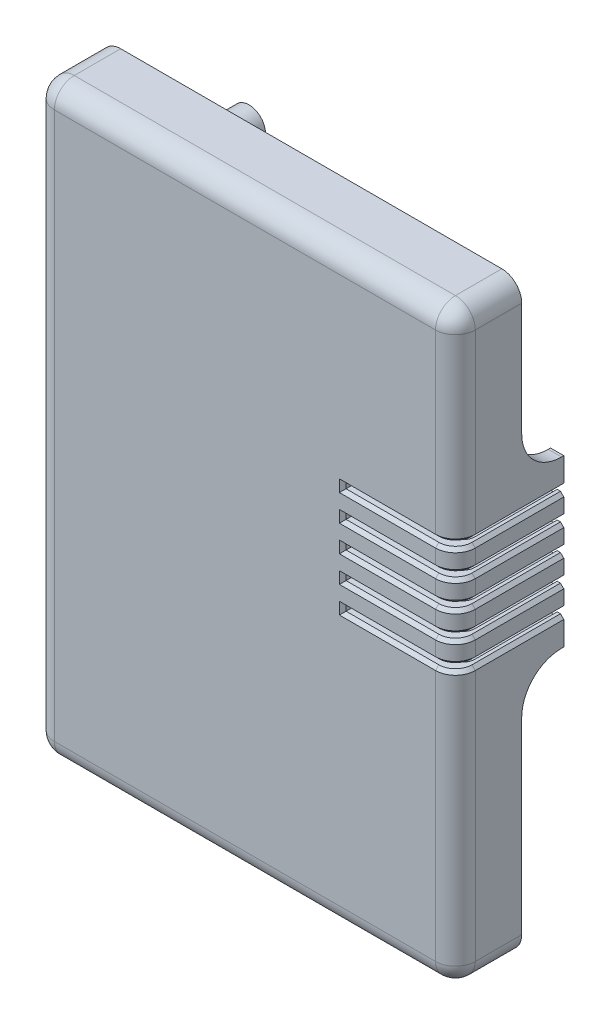
from build123d import *

# Parameters (mm, degrees)
SKETCH2_W                  = 63.5
SKETCH2_H                  = 88.5
BOSS_EXTRUDE1_DEPTH        = 2
BOSS_EXTRUDE2_DEPTH        = 8
BOSS_EXTRUDE3_DEPTH        = 2
SKETCH5_W                  = 15
SKETCH5_H                  = 2
BOSS_EXTRUDE4_DEPTH        = 12
CUT_EXTRUDE1_DEPTH         = 14.35
FILLET1_R                  = 3
FILLET2_R                  = 2
FILLET3_R                  = 3
SKETCH7_W                  = 16.828427125
SKETCH7_H                  = 0.8
CUT_EXTRUDE2_DEPTH         = 10
SKETCH9_R                  = 2.5
BOSS_EXTRUDE5_DEPTH        = 14.35
BOSS_EXTRUDE6_DEPTH        = 0.5
BOSS_EXTRUDE7_DEPTH        = 0.5
BOSS_EXTRUDE8_DEPTH        = 0.5
SKETCH17_W                 = 5.5
SKETCH17_H                 = 9
BOSS_EXTRUDE11_DEPTH       = 0.5
BOSS_EXTRUDE12_DEPTH       = 0.5
BOSS_EXTRUDE13_DEPTH       = 0.5
M2_5_CLEARANCE_HOLE1_D     = 2.9
M2_5_CLEARANCE_HOLE1_DEPTH = 10
M2_5_CLEARANCE_HOLE1_TIP   = 0.871247898
SKETCH8_W                  = 26.800079737
SKETCH8_H                  = 7
CUT_EXTRUDE3_DEPTH         = 3
CHAMFER1_SIZE              = 0.5


with BuildPart() as part:
    # Sketch2 → Boss-Extrude1 (new body)
    with BuildSketch(Plane.XY.offset(8)):
        with Locations((8.071244, 16.046786)):
            Rectangle(SKETCH2_W, SKETCH2_H)
    extrude(amount=BOSS_EXTRUDE1_DEPTH)

    # Sketch3 → Boss-Extrude2 (add)
    with BuildSketch(Plane(origin=(0, 0, 8), x_dir=(-1, 0, 0), z_dir=(0, 0, -1))):
        Polygon((23.678756, -28.203214), (23.678756, 60.296786), (-39.821244, 60.296786), (-39.821244, 58.296786), (-37.821244, 58.296786), (21.678756, 58.296786), (21.678756, -26.203214), (-37.821244, -26.203214), (-39.821244, -26.203214), (-39.821244, -28.203214), align=None)
    extrude(amount=BOSS_EXTRUDE2_DEPTH)

    # Sketch4 → Boss-Extrude3 (add)
    with BuildSketch(Plane(origin=(39.821244, 0, 0), x_dir=(0, 0, -1), z_dir=(1, 0, 0))):
        with BuildLine():
            ThreePointArc((6, 9.206977335), (1.757359313, 7.449618022), (0, 3.206977335))
            Line((0, 3.206977335), (0, -26.203214))
            Line((0, -26.203214), (-8, -26.203214))
            Line((-8, -26.203214), (-8, 58.296786))
            Line((-8, 58.296786), (0, 58.296786))
            Line((0, 58.296786), (0, 40.206977335))
            ThreePointArc((0, 40.206977335), (1.757359313, 35.964336648), (6, 34.206977335))
            Line((6, 34.206977335), (6.35, 34.206977335))
            Line((6.35, 34.206977335), (6.35, 9.206977335))
            Line((6.35, 9.206977335), (6, 9.206977335))
        make_face()
    extrude(amount=-BOSS_EXTRUDE3_DEPTH)

    # Sketch5 → Boss-Extrude4 (add)
    with BuildSketch(Plane(origin=(0, 0, 8), x_dir=(-1, 0, 0), z_dir=(0, 0, -1))):
        with Locations((-30.321244, 31.706977335)):
            Rectangle(SKETCH5_W, SKETCH5_H)
        with Locations((-30.321244, 27.706977335)):
            Rectangle(SKETCH5_W, SKETCH5_H)
        with Locations((-30.321244, 23.706977335)):
            Rectangle(SKETCH5_W, SKETCH5_H)
        with Locations((-30.321244, 19.706977335)):
            Rectangle(SKETCH5_W, SKETCH5_H)
        with Locations((-30.321244, 15.706977335)):
            Rectangle(SKETCH5_W, SKETCH5_H)
        with Locations((-30.321244, 11.706977335)):
            Rectangle(SKETCH5_W, SKETCH5_H)
    extrude(amount=BOSS_EXTRUDE4_DEPTH)

    # Sketch6 → Cut-Extrude1 (cut)
    with BuildSketch(Plane(origin=(0, 0, -6.35), x_dir=(-1, 0, 0), z_dir=(0, 0, -1))):
        Polygon((-37.821244, 30.706977335), (-38.821244, 30.706977335), (-38.821244, 30.106977335), (-39.821244, 30.106977335), (-39.821244, 29.306977335), (-38.821244, 29.306977335), (-38.821244, 28.706977335), (-37.821244, 28.706977335), align=None)
        Polygon((-38.821244, 26.106977335), (-39.821244, 26.106977335), (-39.821244, 25.306977335), (-38.821244, 25.306977335), (-38.821244, 24.706977335), (-37.821244, 24.706977335), (-37.821244, 26.706977335), (-38.821244, 26.706977335), align=None)
        Polygon((-38.821244, 22.106977335), (-39.821244, 22.106977335), (-39.821244, 21.306977335), (-38.821244, 21.306977335), (-38.821244, 20.706977335), (-37.821244, 20.706977335), (-37.821244, 22.706977335), (-38.821244, 22.706977335), align=None)
        Polygon((-38.821244, 18.106977335), (-39.821244, 18.106977335), (-39.821244, 17.306977335), (-38.821244, 17.306977335), (-38.821244, 16.706977335), (-37.821244, 16.706977335), (-37.821244, 18.706977335), (-38.821244, 18.706977335), align=None)
        Polygon((-38.821244, 14.106977335), (-39.821244, 14.106977335), (-39.821244, 13.306977335), (-38.821244, 13.306977335), (-38.821244, 12.706977335), (-37.821244, 12.706977335), (-37.821244, 14.706977335), (-38.821244, 14.706977335), align=None)
    extrude(amount=-CUT_EXTRUDE1_DEPTH, mode=Mode.SUBTRACT)

    # Fillet1
    # the kernel refuses this fillet: 3 mm, written as the material it takes off along each edge
    with BuildSketch(Plane(origin=(-23.678756, -35.703214, 10), x_dir=(0, 0, -1), z_dir=(0, 1, 0)), Plane(origin=(39.821244, 67.796786, 10), x_dir=(0, 0, -1), z_dir=(0, -1, 0))) as fillet1_piece_1:
        with BuildLine():
            CenterArc((FILLET1_R, -FILLET1_R), FILLET1_R, 90, 90)
            Line((0, -FILLET1_R), (0, 0))
            Line((0, 0), (FILLET1_R, 0))
        make_face()
    extrude(amount=103.5, mode=Mode.SUBTRACT)
    with BuildSketch(Plane(origin=(47.321244, -28.203214, 10), x_dir=(0, 0, -1), z_dir=(-1, 0, 0)), Plane(origin=(-31.178756, 60.296786, 10), x_dir=(0, 0, -1), z_dir=(1, 0, 0))) as fillet1_piece_2:
        with BuildLine():
            CenterArc((FILLET1_R, -FILLET1_R), FILLET1_R, 90, 90)
            Line((0, -FILLET1_R), (0, 0))
            Line((0, 0), (FILLET1_R, 0))
        make_face()
    extrude(amount=78.5, mode=Mode.SUBTRACT)

    # Fillet2
    fillet2_edges = [part.edges().sort_by_distance(p)[0] for p in [
        (38.821244, 30.406977335, 8),
        (38.821244, 29.006977335, 8),
        (8.071244, -26.203214, 8),
        (-21.678756, 16.046786, 8),
        (38.821244, 26.406977335, 8),
        (38.821244, 25.006977335, 8),
        (38.821244, 22.406977335, 8),
        (38.821244, 21.006977335, 8),
        (38.821244, 18.406977335, 8),
        (38.821244, 17.006977335, 8),
        (38.821244, 14.406977335, 8),
        (38.821244, 13.006977335, 8),
        (8.071244, 58.296786, 8),
        (37.821244, -7.748118333, 8),
        (37.821244, 45.501881667, 8),
    ]]
    fillet(fillet2_edges, radius=FILLET2_R)

    # Fillet3
    # the kernel refuses this fillet: 3 mm, written as the material it takes off along each edge
    with BuildSketch(Plane(origin=(36.821244, 57.296786, 7), x_dir=(1, 0, 0), z_dir=(0, 1, 0))) as fillet3_piece_1_section:
        Polygon((0, 0), (FILLET3_R, 0), (FILLET3_R, -FILLET3_R), (0, -FILLET3_R), align=None)
    fillet3_piece_1 = extrude(amount=FILLET3_R, mode=Mode.PRIVATE)
    fillet3_piece_1 = fillet3_piece_1 - Plane(origin=(36.821244, 57.296786, 7), x_dir=(-0.7071067811865475, 0, -0.7071067811865475), z_dir=(0, 1, 0)) * Sphere(FILLET3_R, mode=Mode.PRIVATE)
    add(fillet3_piece_1, mode=Mode.SUBTRACT)
    with BuildSketch(Plane(origin=(36.821244, -25.203214, 7), x_dir=(0, -1, 0), z_dir=(1, 0, 0))) as fillet3_piece_2_section:
        Polygon((0, 0), (FILLET3_R, 0), (FILLET3_R, -FILLET3_R), (0, -FILLET3_R), align=None)
    fillet3_piece_2 = extrude(amount=FILLET3_R, mode=Mode.PRIVATE)
    fillet3_piece_2 = fillet3_piece_2 - Plane(origin=(36.821244, -25.203214, 7), x_dir=(0, 0.7071067811865475, -0.7071067811865475), z_dir=(1, 0, 0)) * Sphere(FILLET3_R, mode=Mode.PRIVATE)
    add(fillet3_piece_2, mode=Mode.SUBTRACT)
    with BuildSketch(Plane(origin=(-20.678756, 57.296786, 7), x_dir=(-1, 0, 0), z_dir=(0, 1, 0))) as fillet3_piece_3_section:
        Polygon((0, 0), (FILLET3_R, 0), (FILLET3_R, FILLET3_R), (0, FILLET3_R), align=None)
    fillet3_piece_3 = extrude(amount=FILLET3_R, mode=Mode.PRIVATE)
    fillet3_piece_3 = fillet3_piece_3 - Plane(origin=(-20.678756, 57.296786, 7), x_dir=(0.7071067811865475, 0, -0.7071067811865475), z_dir=(0, 1, 0)) * Sphere(FILLET3_R, mode=Mode.PRIVATE)
    add(fillet3_piece_3, mode=Mode.SUBTRACT)
    with BuildSketch(Plane(origin=(-20.678756, -25.203214, 7), x_dir=(-1, 0, 0), z_dir=(0, -1, 0))) as fillet3_piece_4_section:
        Polygon((0, 0), (FILLET3_R, 0), (FILLET3_R, -FILLET3_R), (0, -FILLET3_R), align=None)
    fillet3_piece_4 = extrude(amount=FILLET3_R, mode=Mode.PRIVATE)
    fillet3_piece_4 = fillet3_piece_4 - Plane(origin=(-20.678756, -25.203214, 7), x_dir=(0.7071067811865475, 0, -0.7071067811865475), z_dir=(0, -1, 0)) * Sphere(FILLET3_R, mode=Mode.PRIVATE)
    add(fillet3_piece_4, mode=Mode.SUBTRACT)
    with BuildSketch(Plane(origin=(-23.678756, 60.296786, -7.5), x_dir=(1, 0, 0), z_dir=(0, 0, 1)), Plane(origin=(39.821244, -28.203214, 7), x_dir=(0, 1, 0), z_dir=(0, 0, -1)), Plane(origin=(39.821244, 60.296786, 7), x_dir=(-1, 0, 0), z_dir=(0, 0, -1))) as fillet3_piece_5:
        with BuildLine():
            CenterArc((FILLET3_R, -FILLET3_R), FILLET3_R, 90, 90)
            Line((0, -FILLET3_R), (0, 0))
            Line((0, 0), (FILLET3_R, 0))
        make_face()
    extrude(amount=14.5, mode=Mode.SUBTRACT)
    with BuildSketch(Plane(origin=(-23.678756, -28.203214, -7.5), x_dir=(1, 0, 0), z_dir=(0, 0, 1))) as fillet3_piece_6:
        with BuildLine():
            CenterArc((FILLET3_R, FILLET3_R), FILLET3_R, 180, 90)
            Line((0, FILLET3_R), (0, 0))
            Line((0, 0), (FILLET3_R, 0))
        make_face()
    extrude(amount=14.5, mode=Mode.SUBTRACT)

    # Sketch7 → Cut-Extrude2 (cut)
    with BuildSketch(Plane(origin=(0, 0, 8), x_dir=(-1, 0, 0), z_dir=(0, 0, -1))):
        with Locations((-31.235457563, 29.706977335)):
            Rectangle(SKETCH7_W, SKETCH7_H)
        with Locations((-31.235457563, 25.706977335)):
            Rectangle(SKETCH7_W, SKETCH7_H)
        with Locations((-31.235457563, 21.706977335)):
            Rectangle(SKETCH7_W, SKETCH7_H)
        with Locations((-31.235457563, 17.706977335)):
            Rectangle(SKETCH7_W, SKETCH7_H)
        with Locations((-31.235457563, 13.706977335)):
            Rectangle(SKETCH7_W, SKETCH7_H)
    extrude(amount=-CUT_EXTRUDE2_DEPTH, mode=Mode.SUBTRACT)

    # Sketch9 → Boss-Extrude5 (add)
    with BuildSketch(Plane(origin=(0, 0, 8), x_dir=(-1, 0, 0), z_dir=(0, 0, -1))):
        with Locations(Location((15.678756, -20.703214, 0), (0, 0, 180))):
            Circle(SKETCH9_R)
        with Locations(Location((-32.321244, 5.296786, 0), (0, 0, 180))):
            Circle(SKETCH9_R)
        with Locations(Location((7.678756, 53.796786, 0), (0, 0, 270))):
            Circle(SKETCH9_R)
    extrude(amount=BOSS_EXTRUDE5_DEPTH)

    # Sketch13 → Boss-Extrude6 (add, symmetric)
    with BuildSketch(Plane.ZY.offset(7.678756)):
        Polygon((8, 48.169093128), (-1, 51.296786), (-1, 58.296786), (8, 58.296786), align=None)
    extrude(amount=BOSS_EXTRUDE6_DEPTH, both=True)

    # Sketch14 → Boss-Extrude7 (add, symmetric)
    with BuildSketch(Plane(origin=(0, 53.796786, 0), x_dir=(1, 0, 0), z_dir=(0, 1, 0))):
        Polygon((-10.178756, 1), (-12.75490496, -8), (-2.60260704, -8), (-5.178756, 1), align=None)
    extrude(amount=BOSS_EXTRUDE7_DEPTH, both=True)

    # Sketch16 → Boss-Extrude8 (add, symmetric)
    with BuildSketch(Plane.ZY.offset(15.678756)):
        Polygon((0, -26.203214), (8, -26.203214), (8, -14.268259814), (-1, -18.203214), (-1, -26.203214), align=None)
    extrude(amount=BOSS_EXTRUDE8_DEPTH, both=True)

    # Sketch17 → Boss-Extrude11 (add, symmetric)
    with BuildSketch(Plane(origin=(0, -20.703214, 0), x_dir=(-1, 0, 0), z_dir=(0, -1, 0))):
        with Locations((18.928756, -3.5)):
            Rectangle(SKETCH17_W, SKETCH17_H)
    extrude(amount=BOSS_EXTRUDE11_DEPTH, both=True)

    # Sketch19 → Boss-Extrude12 (add, symmetric)
    with BuildSketch(Plane(origin=(32.321244, 0, 0), x_dir=(0, 0, -1), z_dir=(1, 0, 0))):
        Polygon((1, 2.796786), (-8, -0.473394636), (-8, 11.706977335), (1, 11.706977335), align=None)
    extrude(amount=BOSS_EXTRUDE12_DEPTH, both=True)

    # Sketch20 → Boss-Extrude13 (add, symmetric)
    with BuildSketch(Plane(origin=(0, 5.296786, 0), x_dir=(-1, 0, 0), z_dir=(0, -1, 0))):
        Polygon((-37.821244, 1), (-29.821244, 1), (-26.330725953, -8), (-37.821244, -8), align=None)
    extrude(amount=BOSS_EXTRUDE13_DEPTH, both=True)

    # M2.5 Clearance Hole1
    with Locations(Plane(origin=(32.321244, 5.296786, -6.35), x_dir=(0, -1, 0), z_dir=(0, 0, -1))):
        with Locations((0, 0), (-48.5, 40), (26, 48)):
            Hole(M2_5_CLEARANCE_HOLE1_D / 2, depth=M2_5_CLEARANCE_HOLE1_DEPTH)
            with Locations((0, 0, -(M2_5_CLEARANCE_HOLE1_DEPTH + M2_5_CLEARANCE_HOLE1_TIP / 2))):  # 118° drill point
                Cone(0, M2_5_CLEARANCE_HOLE1_D / 2, M2_5_CLEARANCE_HOLE1_TIP, mode=Mode.SUBTRACT)

    # Sketch8 → Cut-Extrude3 (cut)
    with BuildSketch(Plane.XZ.offset(28.203214)):
        with Locations((0.390288681, 3.5)):
            Rectangle(SKETCH8_W, SKETCH8_H)
    extrude(amount=-CUT_EXTRUDE3_DEPTH, mode=Mode.SUBTRACT)

    # Chamfer1
    chamfer1_edges = [part.edges().sort_by_distance(p)[0] for p in [
        (39.821244, 26.106977335, 0.325),
        (39.821244, 29.306977335, 0.325),
        (39.821244, 30.106977335, 0.325),
        (39.821244, 13.306977335, 0.325),
        (39.821244, 14.106977335, 0.325),
        (39.821244, 17.306977335, 0.325),
        (39.821244, 18.106977335, 0.325),
        (39.821244, 21.306977335, 0.325),
        (39.821244, 22.106977335, 0.325),
        (39.821244, 25.306977335, 0.325),
        (38.942564344, 30.106977335, 9.121320344),
        (38.942564344, 29.306977335, 9.121320344),
        (38.942564344, 26.106977335, 9.121320344),
        (38.942564344, 25.306977335, 9.121320344),
        (38.942564344, 22.106977335, 9.121320344),
        (38.942564344, 21.306977335, 9.121320344),
        (38.942564344, 18.106977335, 9.121320344),
        (38.942564344, 17.306977335, 9.121320344),
        (38.942564344, 14.106977335, 9.121320344),
        (38.942564344, 13.306977335, 9.121320344),
        (22.821244, 29.706977335, 10),
        (29.821244, 29.306977335, 10),
        (29.821244, 30.106977335, 10),
        (22.821244, 13.706977335, 10),
        (22.821244, 17.706977335, 10),
        (22.821244, 21.706977335, 10),
        (22.821244, 25.706977335, 10),
        (29.821244, 25.306977335, 10),
        (29.821244, 26.106977335, 10),
        (29.821244, 21.306977335, 10),
        (29.821244, 22.106977335, 10),
        (29.821244, 17.306977335, 10),
        (29.821244, 18.106977335, 10),
        (29.821244, 13.306977335, 10),
        (29.821244, 14.106977335, 10),
    ]]
    chamfer(chamfer1_edges, length=CHAMFER1_SIZE)


solid = part.part
